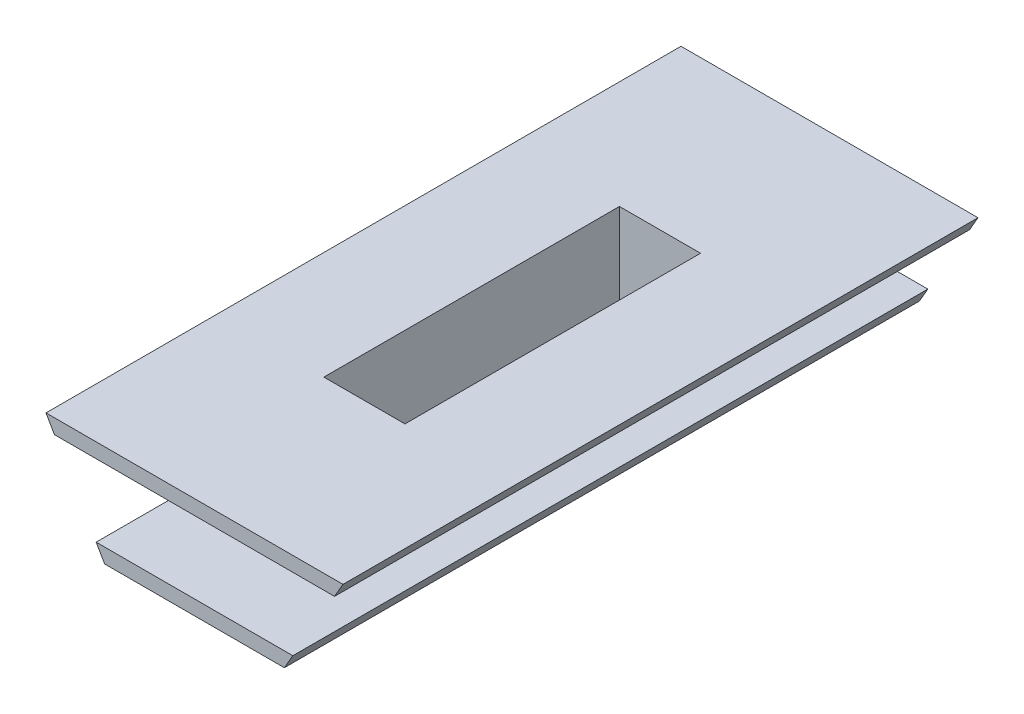
from build123d import *

# Parameters (mm, degrees)
BOSS_EXTRUDE2_DEPTH = 65
SKETCH10_W          = 10.3
SKETCH10_H          = 7.392395682
TOP_CUT_DEPTH       = 16.35
SKETCH11_W          = 10.3
SKETCH11_H          = 7.40522356
BOT_CUT_DEPTH       = 16.35
SKETCH13_W          = 8.3
SKETCH13_H          = 30.255654569
CUT_EXTRUDE8_DEPTH  = 68.55767906


with BuildPart() as part:
    # Casing → Boss-Extrude2 (new body)
    with BuildSketch(Plane.XY):
        Polygon((-9.2, 0), (9.2, 0), (10.066025404, 1.5), (5.15, 1.5), (5.15, 8.892304845), (14.333974596, 8.892304845), (15.2, 10.392304845), (-15.2, 10.392304845), (-14.333974596, 8.892304845), (-5.15, 8.892304845), (-5.15, 1.5), (-10.066025404, 1.5), align=None)
    extrude(amount=BOSS_EXTRUDE2_DEPTH)

    # Sketch10 → Top_Cut (cut)
    with BuildSketch(Plane.XY.offset(65)):
        with Locations((0, 5.196197841)):
            Rectangle(SKETCH10_W, SKETCH10_H)
    extrude(amount=-TOP_CUT_DEPTH, mode=Mode.SUBTRACT)

    # Sketch11 → Bot_Cut (cut)
    with BuildSketch(Plane(origin=(0, 0, 0), x_dir=(-1, 0, 0), z_dir=(0, 0, -1))):
        with Locations((0, 5.20261178)):
            Rectangle(SKETCH11_W, SKETCH11_H)
    extrude(amount=-BOT_CUT_DEPTH, mode=Mode.SUBTRACT)

    # Sketch13 → Cut-Extrude8 (cut, through all)
    with BuildSketch(Plane(origin=(0, 10.392304845, 0), x_dir=(1, 0, 0), z_dir=(0, 1, 0))):
        with Locations((0, -32.477827285)):
            Rectangle(SKETCH13_W, SKETCH13_H)
    extrude(amount=-CUT_EXTRUDE8_DEPTH, mode=Mode.SUBTRACT)


solid = part.part
